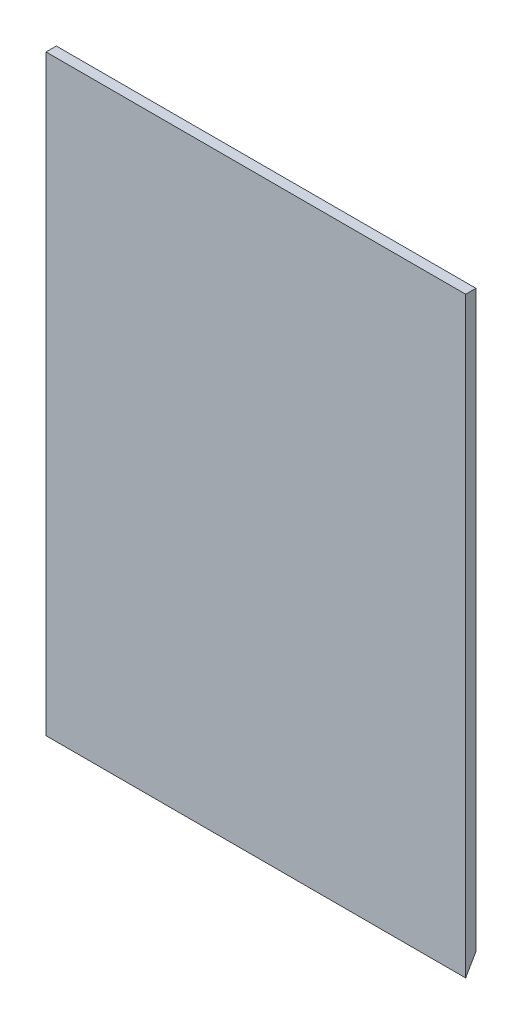
from build123d import *

# Parameters (mm, degrees)
SKETCH1_W           = 207.01
SKETCH1_H           = 292.1
BOSS_EXTRUDE1_DEPTH = 2.54
CUT_EXTRUDE3_DEPTH  = 6.35
CUT_EXTRUDE4_DEPTH  = 6.35


with BuildPart() as part:
    # Sketch1 → Boss-Extrude1 (new, symmetric)
    with BuildSketch(Plane.XY):
        Rectangle(SKETCH1_W, SKETCH1_H)
    extrude(amount=BOSS_EXTRUDE1_DEPTH, both=True)

    # Sketch4 → Cut-Extrude3 (cut)
    with BuildSketch(Plane.ZY.offset(103.505)):
        Polygon((-2.54, -137.251181898), (2.54, -146.05), (-2.54, -146.05), align=None)
    extrude(amount=-CUT_EXTRUDE3_DEPTH, mode=Mode.SUBTRACT)

    # Sketch5 → Cut-Extrude4 (cut)
    with BuildSketch(Plane(origin=(103.505, 0, 0), x_dir=(0, 0, -1), z_dir=(1, 0, 0))):
        Polygon((2.54, -137.251181898), (-2.54, -146.05), (2.54, -146.05), align=None)
    extrude(amount=-CUT_EXTRUDE4_DEPTH, mode=Mode.SUBTRACT)


solid = part.part
